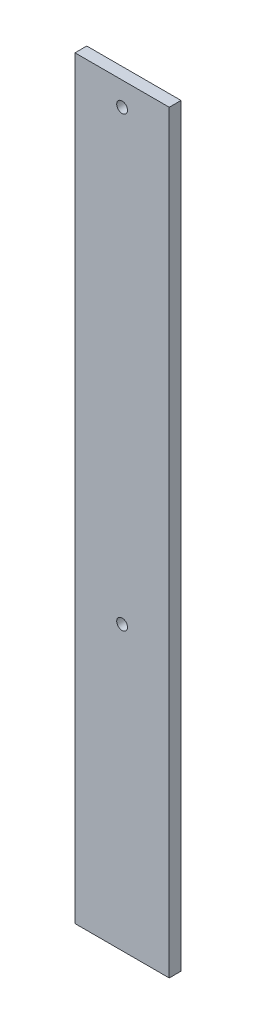
from build123d import *

# Parameters (mm, degrees)
SKETCH2_W           = 25.4
SKETCH2_H           = 203.2
SKETCH2_R           = 1.4605
BOSS_EXTRUDE1_DEPTH = 3.175


with BuildPart() as part:
    # Sketch2 → Boss-Extrude1 (new body)
    with BuildSketch(Plane.XY):
        with Locations((12.7, 101.6)):
            Rectangle(SKETCH2_W, SKETCH2_H)
        with Locations((12.7, 196.85)):
            Circle(SKETCH2_R, mode=Mode.SUBTRACT)
        with Locations((12.7, 76.2)):
            Circle(SKETCH2_R, mode=Mode.SUBTRACT)
    extrude(amount=BOSS_EXTRUDE1_DEPTH)


solid = part.part
